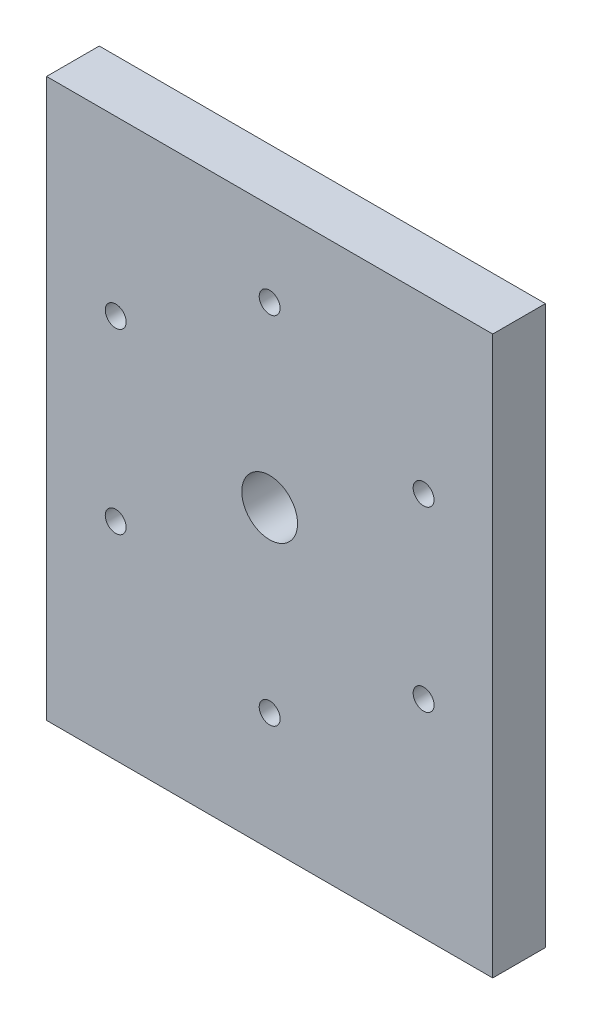
from build123d import *

# Parameters (mm, degrees)
SKETCH1_W           = 101.6
SKETCH1_H           = 127
SKETCH1_R           = 6.35
BOSS_EXTRUDE1_DEPTH = 12.0000014
SKETCH2_R           = 2.38125
CUT_EXTRUDE1_DEPTH  = 138.308557758
CIRPATTERN1_COUNT   = 6
SKETCH3_R           = 2.38125
CUT_EXTRUDE2_DEPTH  = 19.05


with BuildPart() as part:
    # Sketch1 → Boss-Extrude1 (new body)
    with BuildSketch(Plane.XY):
        with Locations((0, 63.5)):
            Rectangle(SKETCH1_W, SKETCH1_H)
        with Locations((0, 67.3749986)):
            Circle(SKETCH1_R, mode=Mode.SUBTRACT)
    extrude(amount=BOSS_EXTRUDE1_DEPTH)

    # Sketch2 → Cut-Extrude1 (cut, through all)
    with BuildSketch(Plane(origin=(0, 0, 0), x_dir=(-1, 0, 0), z_dir=(0, 0, -1))):
        with Locations((0, 107.8562486)):
            Circle(SKETCH2_R)
    cut_extrude1 = extrude(amount=-CUT_EXTRUDE1_DEPTH, mode=Mode.SUBTRACT)

    # CirPattern1: Cut-Extrude1 ×6 about axis
    cirpattern1_axis = Axis((0, 67.3749986, 12.0000014), (0, 0, -1))
    for i in range(1, CIRPATTERN1_COUNT):
        add(cut_extrude1.rotate(cirpattern1_axis, i * 360 / CIRPATTERN1_COUNT), mode=Mode.SUBTRACT)

    # Sketch3 → Cut-Extrude2 (cut)
    with BuildSketch(Plane.XZ):
        with Locations((31.75, 6.0000007)):
            Circle(SKETCH3_R)
        with Locations((0, 6.0000007)):
            Circle(SKETCH3_R)
        with Locations((-31.75, 6.0000007)):
            Circle(SKETCH3_R)
    extrude(amount=-CUT_EXTRUDE2_DEPTH, mode=Mode.SUBTRACT)


solid = part.part
